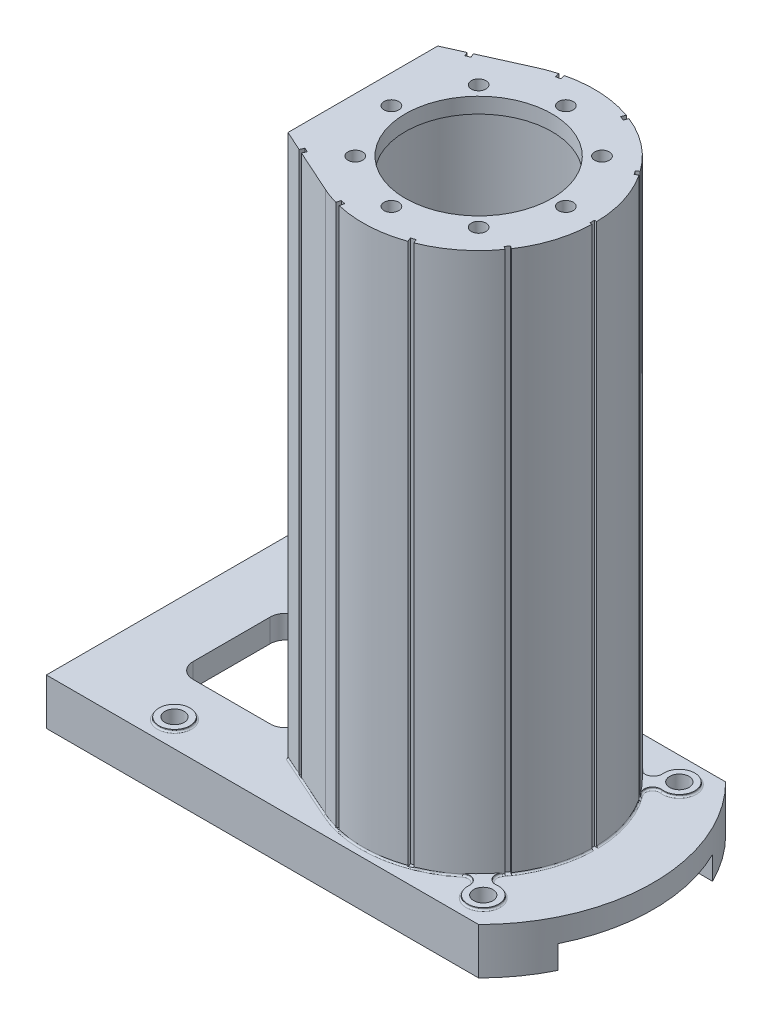
from build123d import *

# Parameters (mm, degrees)
BOSS_EXTRUDE1_DEPTH     = 30
BOSS_EXTRUDE2_DEPTH     = 351.07
SKETCH4_R               = 10
SKETCH4_R_2             = 6.25
BOSS_EXTRUDE3_DEPTH     = 1.5
SKETCH4_2_R             = 6.25
CUT_EXTRUDE1_DEPTH      = 400.532971229
FILLET2_R               = 1
FILLET3_R               = 1
CUT_EXTRUDE2_DEPTH      = 400.532971229
SKETCH7_W               = 100
SKETCH7_H               = 30
CUT_EXTRUDE3_DEPTH      = 500.669069381
CUT_EXTRUDE4_DEPTH      = 413.775598962
CUT_EXTRUDE4_DEPTH_BACK = 356.07
SKETCH8_R               = 62.5
SKETCH9_R               = 47.5
CUT_EXTRUDE5_DEPTH      = 427.134714731
SKETCH10_R              = 4.75
CUT_EXTRUDE6_DEPTH      = 427.134714731
CIRPATTERN1_COUNT       = 8
CUT_EXTRUDE7_START      = -351.07
SKETCH11_W              = 3
SKETCH11_H              = 3
CUT_EXTRUDE7_DEPTH      = 351.07
CRVPATTERN5_START       = 30
CRVPATTERN5_DEPTH       = 351.07
CRVPATTERN6_START       = 30
CRVPATTERN6_DEPTH       = 351.07


# Read off the part's stored shape, not the designer's step: CrvPattern5, CrvPattern6
with BuildPart() as part:
    # Sketch1 → Boss-Extrude1 (new body)
    with BuildSketch(Plane(origin=(0, 0, 0), x_dir=(1, 0, 0), z_dir=(0, 1, 0))):
        with BuildLine():
            Line((-140, 80), (-140, -80))
            Line((-140, -80), (140, -80))
            ThreePointArc((140, -80), (173.13708499, 0), (140, 80))
            Line((140, 80), (-140, 80))
        make_face()
    extrude(amount=BOSS_EXTRUDE1_DEPTH)

    # Sketch2 → Boss-Extrude2 (add)
    with BuildSketch(Plane(origin=(0, 30, 0), x_dir=(1, 0, 0), z_dir=(0, 1, 0))):
        with BuildLine():
            Line((-15, 48.5), (-15, -48.5))
            Line((-15, -48.5), (29.230467893, -68.397630762))
            ThreePointArc((29.230467893, -68.397630762), (135, 0), (29.230467893, 68.397630762))
            Line((29.230467893, 68.397630762), (-15, 48.5))
        make_face()
    extrude(amount=BOSS_EXTRUDE2_DEPTH)

    # Sketch4 → Boss-Extrude3 (add)
    # profile 1 of 4: a face of its own
    with BuildSketch(Plane(origin=(0, 30, 0), x_dir=(1, 0, 0), z_dir=(0, 1, 0))):
        with Locations(Location((-73.5, 63.5, 0), (0, 0, 270))):
            Circle(SKETCH4_R)
        with Locations(Location((-73.5, 63.5, 0), (0, 0, 270))):
            Circle(SKETCH4_R_2, mode=Mode.SUBTRACT)
    # profile 2 of 4: a face of its own
    with BuildSketch(Plane(origin=(0, 30, 0), x_dir=(1, 0, 0), z_dir=(0, 1, 0))):
        with Locations(Location((-73.5, -63.5, 0), (0, 0, 90))):
            Circle(SKETCH4_R)
        with Locations(Location((-73.5, -63.5, 0), (0, 0, 90))):
            Circle(SKETCH4_R_2, mode=Mode.SUBTRACT)
    # profile 3 of 4: a face of its own
    with BuildSketch(Plane(origin=(0, 30, 0), x_dir=(1, 0, 0), z_dir=(0, 1, 0))):
        with BuildLine():
            ThreePointArc((125.229287043, 53.581064141), (133.73232079, 70.406050679), (116.533005991, 62.688193117))
            ThreePointArc((116.533005991, 62.688193117), (113.603435659, 57.36975051), (107.563191881, 57.989160867))
            ThreePointArc((107.563191881, 57.989160867), (114.242405927, 51.795380096), (120.121485947, 44.83756157))
            ThreePointArc((120.121485947, 44.83756157), (119.781367064, 50.89994833), (125.229287043, 53.581064141))
        make_face()
        with Locations(Location((126.5, 63.5, 0), (0, 0, 270))):
            Circle(SKETCH4_R_2, mode=Mode.SUBTRACT)
    # profile 4 of 4: a face of its own
    with BuildSketch(Plane(origin=(0, 30, 0), x_dir=(1, 0, 0), z_dir=(0, 1, 0))):
        with BuildLine():
            ThreePointArc((107.563191881, -57.989160867), (114.242405927, -51.795380096), (120.121485947, -44.83756157))
            ThreePointArc((120.121485947, -44.83756157), (119.781367064, -50.89994833), (125.229287043, -53.581064141))
            ThreePointArc((125.229287043, -53.581064141), (133.73232079, -70.406050679), (116.533005991, -62.688193117))
            ThreePointArc((116.533005991, -62.688193117), (113.603435659, -57.36975051), (107.563191881, -57.989160867))
        make_face()
        with Locations(Location((126.5, -63.5, 0), (0, 0, 90))):
            Circle(SKETCH4_R_2, mode=Mode.SUBTRACT)
    extrude(amount=BOSS_EXTRUDE3_DEPTH)

    # Sketch4<2> → Cut-Extrude1 (cut, through all)
    with BuildSketch(Plane(origin=(0, 30, 0), x_dir=(1, 0, 0), z_dir=(0, 1, 0))):
        with Locations(Location((-73.5, -63.5, 0), (0, 0, 90))):
            Circle(SKETCH4_2_R)
        with Locations(Location((-73.5, 63.5, 0), (0, 0, 270))):
            Circle(SKETCH4_2_R)
        with Locations(Location((126.5, -63.5, 0), (0, 0, 90))):
            Circle(SKETCH4_2_R)
        with Locations(Location((126.5, 63.5, 0), (0, 0, 270))):
            Circle(SKETCH4_2_R)
    extrude(amount=-CUT_EXTRUDE1_DEPTH, mode=Mode.SUBTRACT)

    # Fillet2
    fillet2_edges = [part.edges().sort_by_distance(p)[0] for p in [
        (-73.5, 30, -73.5),
        (-73.5, 30, 73.5),
    ]]
    fillet(fillet2_edges, radius=FILLET2_R)

    # Fillet3
    fillet3_edges = [part.edges().sort_by_distance(p)[0] for p in [
        (7.115233947, 30, -58.448815381),
        (7.115233947, 30, 58.448815381),
        (69.878806281, 30, 74.346547912),
        (135, 30, 0),
        (113.603435659, 30, 57.36975051),
        (133.73232079, 30, 70.406050679),
        (119.781367064, 30, 50.89994833),
        (69.878806281, 30, -74.346547912),
        (119.781367064, 30, -50.89994833),
        (133.73232079, 30, -70.406050679),
        (113.603435659, 30, -57.36975051),
    ]]
    fillet(fillet3_edges, radius=FILLET3_R)

    # Sketch6 → Cut-Extrude2 (cut, through all)
    with BuildSketch(Plane(origin=(0, 30, 0), x_dir=(1, 0, 0), z_dir=(0, 1, 0))):
        with BuildLine():
            Line((-90, 35), (-40, 35))
            ThreePointArc((-40, 35), (-32.928932188, 32.071067812), (-30, 25))
            Line((-30, 25), (-30, -25))
            ThreePointArc((-30, -25), (-32.928932188, -32.071067812), (-40, -35))
            Line((-40, -35), (-90, -35))
            ThreePointArc((-90, -35), (-97.071067812, -32.071067812), (-100, -25))
            Line((-100, -25), (-100, 25))
            ThreePointArc((-100, 25), (-97.071067812, 32.071067812), (-90, 35))
        make_face()
    extrude(amount=-CUT_EXTRUDE2_DEPTH, mode=Mode.SUBTRACT)

    # Sketch7 → Cut-Extrude3 (cut, through all)
    with BuildSketch(Plane.ZY.offset(140)):
        Rectangle(SKETCH7_W, SKETCH7_H)
    extrude(amount=-CUT_EXTRUDE3_DEPTH, mode=Mode.SUBTRACT)

    # Sketch8 → Cut-Extrude4 (cut, two sides: drawn at the far end of the back side and taken through both)
    with BuildSketch(Plane.XZ.offset(-15).offset(-CUT_EXTRUDE4_DEPTH_BACK)):
        with Locations(Location((60, 0, 0), (0, 0, 306.869897646))):
            Circle(SKETCH8_R)
    extrude(amount=CUT_EXTRUDE4_DEPTH + CUT_EXTRUDE4_DEPTH_BACK, mode=Mode.SUBTRACT)

    # Sketch9 → Cut-Extrude5 (cut, through all)
    with BuildSketch(Plane(origin=(0, 381.07, 0), x_dir=(1, 0, 0), z_dir=(0, 1, 0))):
        with Locations(Location((60, 0, 0), (0, 0, 270))):
            Circle(SKETCH9_R)
    extrude(amount=-CUT_EXTRUDE5_DEPTH, mode=Mode.SUBTRACT)

    # Sketch10 → Cut-Extrude6 (cut, through all)
    with BuildSketch(Plane(origin=(0, 381.07, 0), x_dir=(1, 0, 0), z_dir=(0, 1, 0))):
        with Locations(Location((3.5, 0, 0), (0, 0, 270))):
            Circle(SKETCH10_R)
    cut_extrude6 = extrude(amount=-CUT_EXTRUDE6_DEPTH, mode=Mode.SUBTRACT)

    # CirPattern1: Cut-Extrude6 ×8 about axis
    cirpattern1_axis = Axis((60, 0, 0), (0, 1, 0))
    for i in range(1, CIRPATTERN1_COUNT):
        add(cut_extrude6.rotate(cirpattern1_axis, i * 360 / CIRPATTERN1_COUNT), mode=Mode.SUBTRACT)

    # Sketch11 → Cut-Extrude7 (cut)
    with BuildSketch(Plane(origin=(0, 381.07, 0), x_dir=(1, 0, 0), z_dir=(0, 1, 0)).offset(CUT_EXTRUDE7_START)):
        with Locations((135, 0)):
            Rectangle(SKETCH11_W, SKETCH11_H)
    extrude(amount=CUT_EXTRUDE7_DEPTH, mode=Mode.SUBTRACT)

    # CrvPattern5 outline → CrvPattern5 (cut)
    with BuildSketch(Plane(origin=(0, 0, 0), x_dir=(1, 0, 0), z_dir=(0, 1, 0)).offset(CRVPATTERN5_START)):
        Polygon((123.140794768, 41.68667873), (121.446867348, 44.162685575), (118.970860504, 42.468758155), (120.664787924, 39.99275131), align=None)
        Polygon((2.04414202, 52.983411759), (0.868325021, 55.74338538), (-1.891648599, 54.567568381), (-0.7158316, 51.807594761), align=None)
        Polygon((43.319055913, 70.063191694), (42.637449629, 72.984734587), (39.715906736, 72.303128303), (40.39751302, 69.38158541), align=None)
        Polygon((86.642860544, 66.990890834), (87.729933808, 69.787008092), (84.93381655, 70.874081355), (83.846743286, 68.077964097), align=None)
    extrude(amount=CRVPATTERN5_DEPTH, mode=Mode.SUBTRACT)

    # CrvPattern6 outline → CrvPattern6 (cut)
    with BuildSketch(Plane(origin=(0, 0, 0), x_dir=(1, 0, 0), z_dir=(0, 1, 0)).offset(CRVPATTERN6_START)):
        Polygon((-0.7158316, -51.807594761), (-1.891648599, -54.567568381), (0.868325021, -55.74338538), (2.04414202, -52.983411759), align=None)
        Polygon((39.715906736, -72.303128303), (42.637449629, -72.984734587), (43.319055913, -70.063191694), (40.39751302, -69.38158541), align=None)
        Polygon((118.970860504, -42.468758155), (121.446867348, -44.162685575), (123.140794768, -41.68667873), (120.664787924, -39.99275131), align=None)
        Polygon((83.846743286, -68.077964097), (84.93381655, -70.874081355), (87.729933808, -69.787008092), (86.642860544, -66.990890834), align=None)
    extrude(amount=CRVPATTERN6_DEPTH, mode=Mode.SUBTRACT)


solid = part.part
